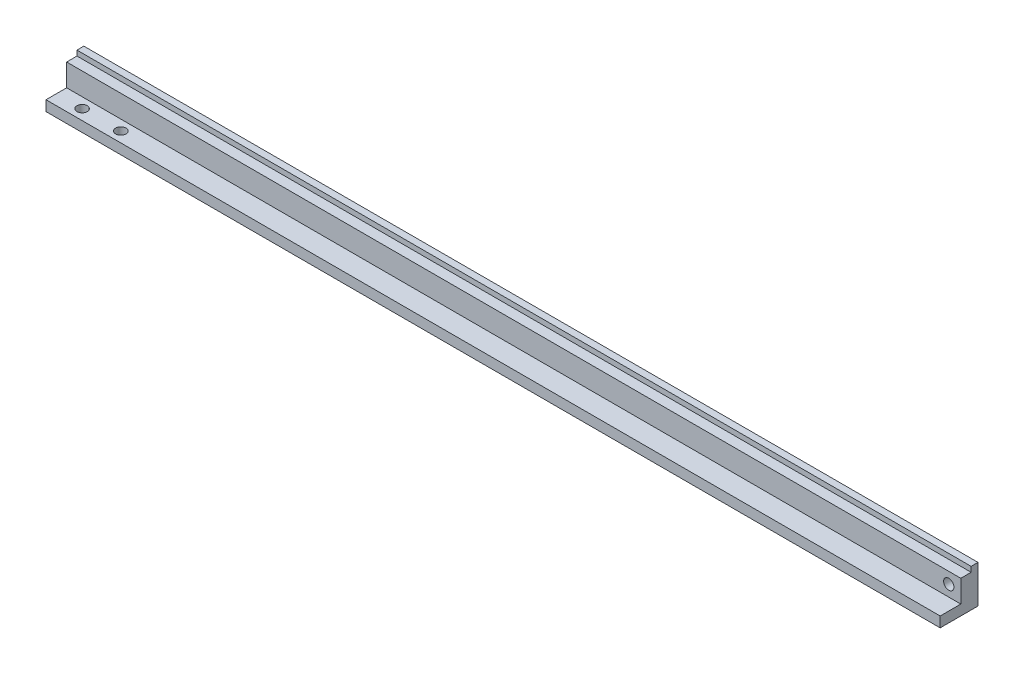
from build123d import *

# Parameters (mm, degrees)
EXTRUDE_1_DEPTH     = 260
SKETCH_2_R          = 1.5
CUT_EXTRUDE_1_DEPTH = 261.301747977
SKETCH_3_R          = 1.5
CUT_EXTRUDE_2_DEPTH = 261.355526156


with BuildPart() as part:
    # Эскиз1 → Бобышка-Вытянуть1 (new body)
    with BuildSketch(Plane(origin=(0, 0, 0), x_dir=(0, 0, -1), z_dir=(1, 0, 0))):
        Polygon((0, 0), (-11, 0), (-11, 3), (-5, 3), (-5, 9.5), (-2, 9.5), (-2, 11), (0, 11), align=None)
    extrude(amount=EXTRUDE_1_DEPTH)

    # Эскиз2 → Вырез-Вытянуть1 (cut, through all)
    with BuildSketch(Plane.XY.offset(5)):
        with Locations((256.5, 6.25)):
            Circle(SKETCH_2_R)
    extrude(amount=-CUT_EXTRUDE_1_DEPTH, mode=Mode.SUBTRACT)

    # Эскиз3 → Вырез-Вытянуть2 (cut, through all)
    with BuildSketch(Plane(origin=(0, 3, 0), x_dir=(1, 0, 0), z_dir=(0, 1, 0))):
        with Locations((7.5, -8)):
            Circle(SKETCH_3_R)
        with Locations((18.75, -8)):
            Circle(SKETCH_3_R)
    extrude(amount=-CUT_EXTRUDE_2_DEPTH, mode=Mode.SUBTRACT)


solid = part.part
